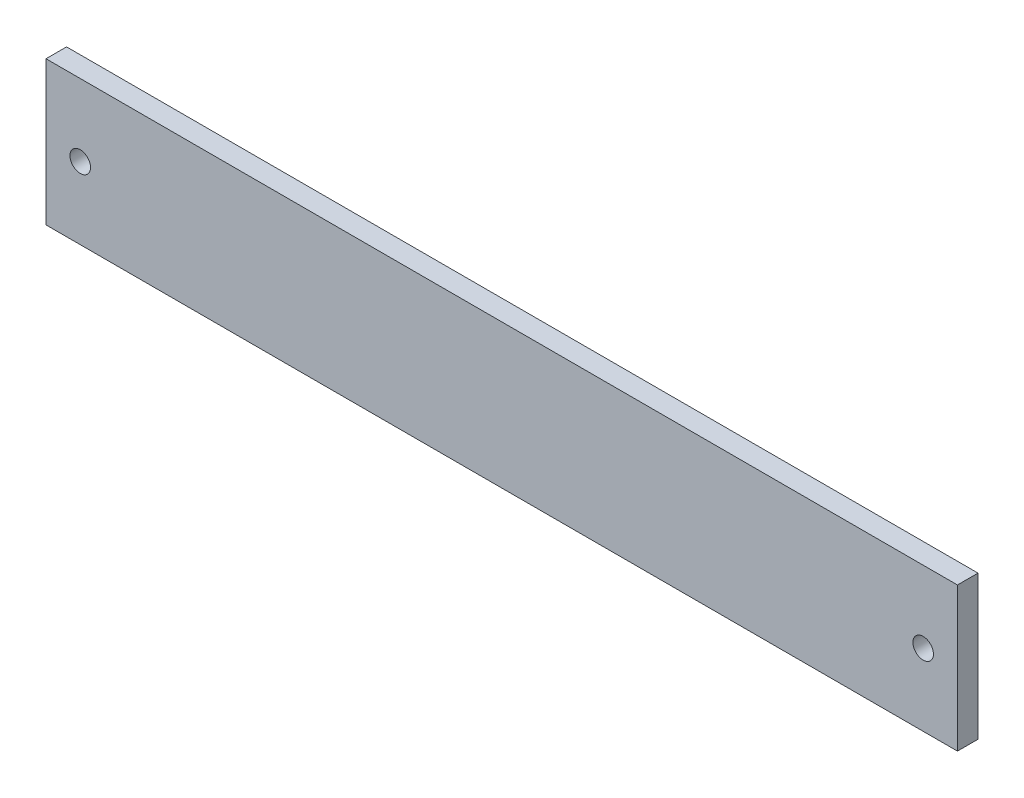
from build123d import *

# Parameters (mm, degrees)
SKETCH1_W           = 133
SKETCH1_H           = 21
SKETCH1_R           = 1.5
BOSS_EXTRUDE1_DEPTH = 3


with BuildPart() as part:
    # Sketch1 → Boss-Extrude1 (new body)
    with BuildSketch(Plane.XY):
        Rectangle(SKETCH1_W, SKETCH1_H)
        with Locations((-61.5, 0)):
            Circle(SKETCH1_R, mode=Mode.SUBTRACT)
        with Locations((61.5, 0)):
            Circle(SKETCH1_R, mode=Mode.SUBTRACT)
    extrude(amount=BOSS_EXTRUDE1_DEPTH)


solid = part.part
